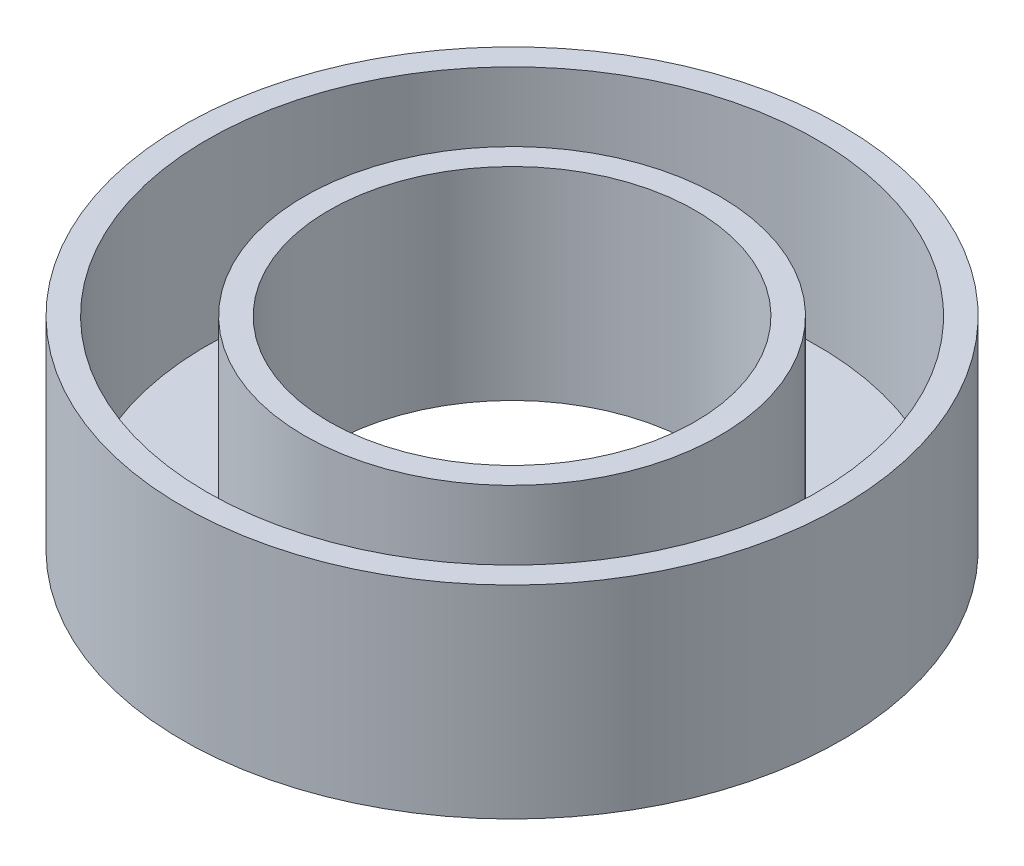
from build123d import *

# Parameters (mm, degrees)
SKETCH1_R            = 13.5
MAIN_EXTRUSION_DEPTH = 8.3
SKETCH2_R            = 7.5
ID_BORE_DEPTH        = 20
SKETCH3_R            = 12.5
SKETCH3_R_2          = 8.5
SEAL_RECESS_DEPTH    = 7.3


with BuildPart() as part:
    # Sketch1 → main extrusion (new body)
    with BuildSketch(Plane(origin=(0, 0, 0), x_dir=(1, 0, 0), z_dir=(0, 1, 0))):
        Circle(SKETCH1_R)
    extrude(amount=MAIN_EXTRUSION_DEPTH)

    # Sketch2 → ID bore (cut)
    with BuildSketch(Plane(origin=(0, 8.3, 0), x_dir=(1, 0, 0), z_dir=(0, 1, 0))):
        Circle(SKETCH2_R)
    extrude(amount=-ID_BORE_DEPTH, mode=Mode.SUBTRACT)

    # Sketch3 → seal recess (cut)
    with BuildSketch(Plane(origin=(0, 8.3, 0), x_dir=(1, 0, 0), z_dir=(0, 1, 0))):
        Circle(SKETCH3_R)
        Circle(SKETCH3_R_2, mode=Mode.SUBTRACT)
    extrude(amount=-SEAL_RECESS_DEPTH, mode=Mode.SUBTRACT)


solid = part.part
